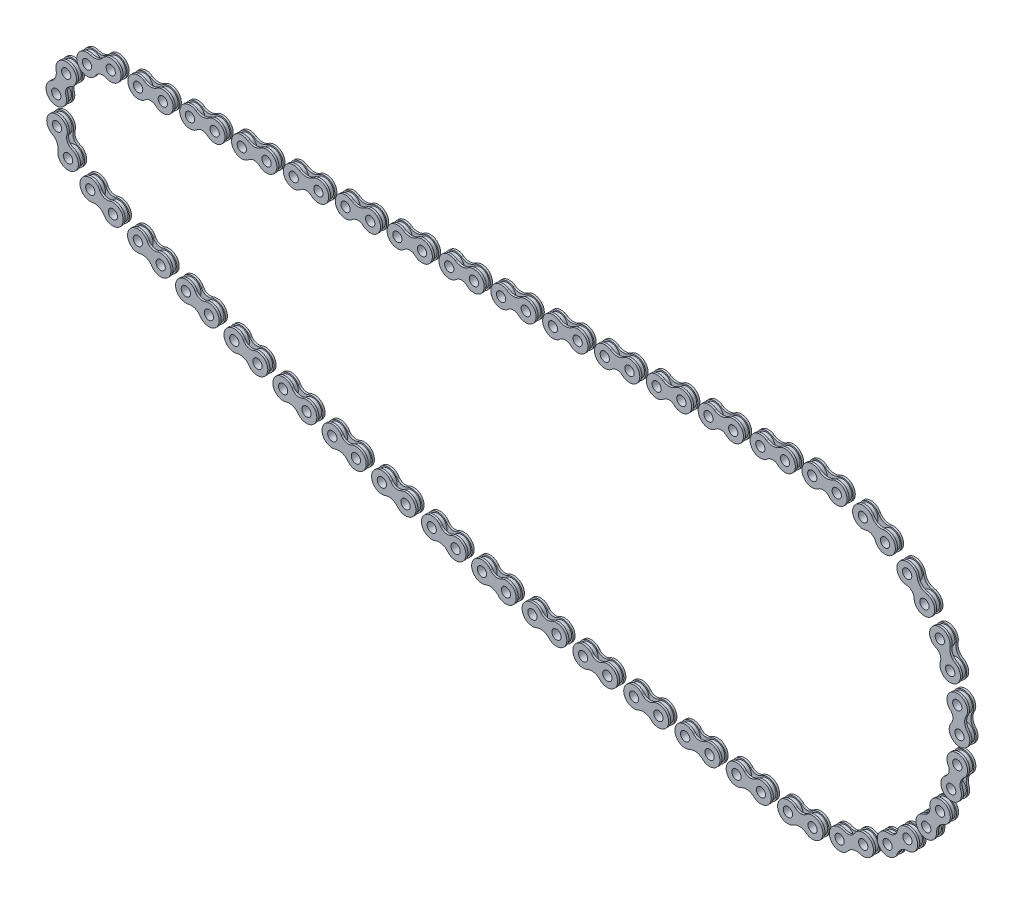
from build123d import *

# Parameters (mm, degrees)
SKETCH1_R             = 4.445
SKETCH1_R_2           = 2.286
BOSS_EXTRUDE1_DEPTH   = 1.016
BOSS_EXTRUDE1_2_DEPTH = 1.016
SKETCH2_R             = 2.286
BOSS_EXTRUDE2_DEPTH   = 1.016
CRVPATTERN1_5_ANGLE   = 6.5404685
CRVPATTERN1_6_ANGLE   = 26.1055224
CRVPATTERN1_7_ANGLE   = 45.6705764
CRVPATTERN1_8_ANGLE   = 65.2356303
CRVPATTERN1_9_ANGLE   = 84.8006843
CRVPATTERN1_10_ANGLE  = 104.3657382
CRVPATTERN1_11_ANGLE  = 123.9307922
CRVPATTERN1_12_ANGLE  = 143.4958461
CRVPATTERN1_13_ANGLE  = 163.0609
CRVPATTERN1_14_ANGLE  = 177.374046
CRVPATTERN1_15_ANGLE  = 172.7025231
CRVPATTERN1_16_ANGLE  = 171.4340196
CRVPATTERN1_17_ANGLE  = 170.1655161
CRVPATTERN1_18_ANGLE  = 168.8970126
CRVPATTERN1_19_ANGLE  = 167.6285091
CRVPATTERN1_20_ANGLE  = 166.3600056
CRVPATTERN1_21_ANGLE  = 165.0915021
CRVPATTERN1_22_ANGLE  = 163.8229986
CRVPATTERN1_23_ANGLE  = 162.5544951
CRVPATTERN1_24_ANGLE  = 161.2859916
CRVPATTERN1_25_ANGLE  = 160.0174881
CRVPATTERN1_26_ANGLE  = 158.7489846
CRVPATTERN1_27_ANGLE  = 157.4804811
CRVPATTERN1_28_ANGLE  = 156.2119776
CRVPATTERN1_29_ANGLE  = 116.6268588
CRVPATTERN1_30_ANGLE  = 66.4382422
CRVPATTERN1_31_ANGLE  = 16.2496255


with BuildPart() as part:
    # Sketch1 → Boss-Extrude1 (new, symmetric)
    with BuildSketch(Plane.XY):
        with Locations((-6.096, 0)):
            Circle(SKETCH1_R)
        with Locations((-6.096, 0)):
            Circle(SKETCH1_R_2, mode=Mode.SUBTRACT)
    extrude(amount=BOSS_EXTRUDE1_DEPTH, both=True)



with BuildPart() as body_2:
    # Sketch1 → Boss-Extrude1 2 (new, symmetric)
    with BuildSketch(Plane.XY):
        with Locations(Location((6.096, 0, 0), (0, 0, 180))):
            Circle(SKETCH1_R)
        with Locations((6.096, 0)):
            Circle(SKETCH1_R_2, mode=Mode.SUBTRACT)
    extrude(amount=BOSS_EXTRUDE1_2_DEPTH, both=True)


with BuildPart() as part_1:
    add(part.part)

    add(body_2.part)  # Boss-Extrude2 merges body 2
    # Sketch2 → Boss-Extrude2 (add)
    with BuildSketch(Plane.XY.offset(1.016)):
        with BuildLine():
            ThreePointArc((-3.149213448, 4.13797644), (-11.165699297, -0.323340436), (-2.647396243, -3.730084734))
            ThreePointArc((-2.647396243, -3.730084734), (0, -2.6937927), (2.647396243, -3.730084734))
            ThreePointArc((2.647396243, -3.730084734), (11.165699297, -0.323340436), (3.149213448, 4.13797644))
            ThreePointArc((3.149213448, 4.13797644), (0, 3.131241405), (-3.149213448, 4.13797644))
        make_face()
        with Locations((6.096, 0)):
            Circle(SKETCH2_R, mode=Mode.SUBTRACT)
        with Locations((-6.096, 0)):
            Circle(SKETCH2_R, mode=Mode.SUBTRACT)
    extrude(amount=BOSS_EXTRUDE2_DEPTH)

    # Mirror1: part across plane


with BuildPart() as part_2:
    add(part_1.part)
    add(part_1.part.mirror(Plane.XY))


with BuildPart() as body_2_2:
    # CrvPattern1: read off the stored shape, not the designer's step
    # CrvPattern1: copy of part
    add(part_2.part.moved(Location((25.5866925, 0, 0))))


with BuildPart() as body_3:
    # CrvPattern1 2: copy of part
    add(part_2.part.moved(Location((51.173385, 0, 0))))


with BuildPart() as body_4:
    # CrvPattern1 3: copy of part
    add(part_2.part.moved(Location((76.7600775, 0, 0))))


with BuildPart() as body_5:
    # CrvPattern1 4: copy of part
    add(part_2.part.moved(Location((102.34677, 0, 0))))


with BuildPart() as body_6:
    # CrvPattern1 5: copy of part
    add(part_2.part.moved(Location((127.134345, 14.085439, 0))).rotate(Axis((0, 0, 0), (0, 0, -1)), CRVPATTERN1_5_ANGLE))


with BuildPart() as body_7:
    # CrvPattern1 6: copy of part
    add(part_2.part.moved(Location((140.1587419, 60.1710301, 0))).rotate(Axis((0, 0, 0), (0, 0, -1)), CRVPATTERN1_6_ANGLE))


with BuildPart() as body_8:
    # CrvPattern1 7: copy of part
    add(part_2.part.moved(Location((136.9981336, 107.9572957, 0))).rotate(Axis((0, 0, 0), (0, 0, -1)), CRVPATTERN1_7_ANGLE))


with BuildPart() as body_9:
    # CrvPattern1 8: copy of part
    add(part_2.part.moved(Location((118.0174951, 151.9260573, 0))).rotate(Axis((0, 0, 0), (0, 0, -1)), CRVPATTERN1_8_ANGLE))


with BuildPart() as body_10:
    # CrvPattern1 9: copy of part
    add(part_2.part.moved(Location((85.4086395, 186.9999673, 0))).rotate(Axis((0, 0, 0), (0, 0, -1)), CRVPATTERN1_9_ANGLE))


with BuildPart() as body_11:
    # CrvPattern1 10: copy of part
    add(part_2.part.moved(Location((42.9371149, 209.1288223, 0))).rotate(Axis((0, 0, 0), (0, 0, -1)), CRVPATTERN1_10_ANGLE))


with BuildPart() as body_12:
    # CrvPattern1 11: copy of part
    add(part_2.part.moved(Location((-4.4926265, 215.7572653, 0))).rotate(Axis((0, 0, 0), (0, 0, -1)), CRVPATTERN1_11_ANGLE))


with BuildPart() as body_13:
    # CrvPattern1 12: copy of part
    add(part_2.part.moved(Location((-51.4035763, 206.1198684, 0))).rotate(Axis((0, 0, 0), (0, 0, -1)), CRVPATTERN1_12_ANGLE))


with BuildPart() as body_14:
    # CrvPattern1 13: copy of part
    add(part_2.part.moved(Location((-92.3786341, 181.3295222, 0))).rotate(Axis((0, 0, 0), (0, 0, -1)), CRVPATTERN1_13_ANGLE))


with BuildPart() as body_15:
    # CrvPattern1 14: copy of part
    add(part_2.part.moved(Location((-122.6861541, 144.2489227, 0))).rotate(Axis((0, 0, 0), (0, 0, 1)), CRVPATTERN1_14_ANGLE))


with BuildPart() as body_16:
    # CrvPattern1 15: copy of part
    add(part_2.part.moved(Location((-108.4503689, 134.2020966, 0))).rotate(Axis((0, 0, 0), (0, 0, 1)), CRVPATTERN1_15_ANGLE))


with BuildPart() as body_17:
    # CrvPattern1 16: copy of part
    add(part_2.part.moved(Location((-85.8108187, 132.0515799, 0))).rotate(Axis((0, 0, 0), (0, 0, 1)), CRVPATTERN1_16_ANGLE))


with BuildPart() as body_18:
    # CrvPattern1 17: copy of part
    add(part_2.part.moved(Location((-63.1292092, 130.402779, 0))).rotate(Axis((0, 0, 0), (0, 0, 1)), CRVPATTERN1_17_ANGLE))


with BuildPart() as body_19:
    # CrvPattern1 18: copy of part
    add(part_2.part.moved(Location((-40.4166575, 129.2565021, 0))).rotate(Axis((0, 0, 0), (0, 0, 1)), CRVPATTERN1_18_ANGLE))


with BuildPart() as body_20:
    # CrvPattern1 19: copy of part
    add(part_2.part.moved(Location((-17.684296, 128.613311, 0))).rotate(Axis((0, 0, 0), (0, 0, 1)), CRVPATTERN1_19_ANGLE))


with BuildPart() as body_21:
    # CrvPattern1 20: copy of part
    add(part_2.part.moved(Location((5.0567333, 128.4735209, 0))).rotate(Axis((0, 0, 0), (0, 0, 1)), CRVPATTERN1_20_ANGLE))


with BuildPart() as body_22:
    # CrvPattern1 21: copy of part
    add(part_2.part.moved(Location((27.7952841, 128.8372004, 0))).rotate(Axis((0, 0, 0), (0, 0, 1)), CRVPATTERN1_21_ANGLE))


with BuildPart() as body_23:
    # CrvPattern1 22: copy of part
    add(part_2.part.moved(Location((50.5202113, 129.7041713, 0))).rotate(Axis((0, 0, 0), (0, 0, 1)), CRVPATTERN1_22_ANGLE))


with BuildPart() as body_24:
    # CrvPattern1 23: copy of part
    add(part_2.part.moved(Location((73.2203765, 131.0740085, 0))).rotate(Axis((0, 0, 0), (0, 0, 1)), CRVPATTERN1_23_ANGLE))


with BuildPart() as body_25:
    # CrvPattern1 24: copy of part
    add(part_2.part.moved(Location((95.8846535, 132.9460406, 0))).rotate(Axis((0, 0, 0), (0, 0, 1)), CRVPATTERN1_24_ANGLE))


with BuildPart() as body_26:
    # CrvPattern1 25: copy of part
    add(part_2.part.moved(Location((118.5019335, 135.3193502, 0))).rotate(Axis((0, 0, 0), (0, 0, 1)), CRVPATTERN1_25_ANGLE))


with BuildPart() as body_27:
    # CrvPattern1 26: copy of part
    add(part_2.part.moved(Location((141.061131, 138.1927739, 0))).rotate(Axis((0, 0, 0), (0, 0, 1)), CRVPATTERN1_26_ANGLE))


with BuildPart() as body_28:
    # CrvPattern1 27: copy of part
    add(part_2.part.moved(Location((163.5511888, 141.5649034, 0))).rotate(Axis((0, 0, 0), (0, 0, 1)), CRVPATTERN1_27_ANGLE))


with BuildPart() as body_29:
    # CrvPattern1 28: copy of part
    add(part_2.part.moved(Location((185.9610835, 145.4340859, 0))).rotate(Axis((0, 0, 0), (0, 0, 1)), CRVPATTERN1_28_ANGLE))


with BuildPart() as body_30:
    # CrvPattern1 29: copy of part
    add(part_2.part.moved(Location((73.4098027, 240.7077324, 0))).rotate(Axis((0, 0, 0), (0, 0, 1)), CRVPATTERN1_29_ANGLE))


with BuildPart() as body_31:
    # CrvPattern1 30: copy of part
    add(part_2.part.moved(Location((-115.4859782, 221.0029082, 0))).rotate(Axis((0, 0, 0), (0, 0, 1)), CRVPATTERN1_30_ANGLE))


with BuildPart() as body_32:
    # CrvPattern1 31: copy of part
    add(part_2.part.moved(Location((-221.292445, 63.2851613, 0))).rotate(Axis((0, 0, 0), (0, 0, 1)), CRVPATTERN1_31_ANGLE))


with BuildPart() as body_33:
    # CrvPattern1 32: copy of part
    add(part_2.part.moved(Location((-204.69354, 0, 0))))


with BuildPart() as body_34:
    # CrvPattern1 33: copy of part
    add(part_2.part.moved(Location((-179.1068475, 0, 0))))


with BuildPart() as body_35:
    # CrvPattern1 34: copy of part
    add(part_2.part.moved(Location((-153.520155, 0, 0))))


with BuildPart() as body_36:
    # CrvPattern1 35: copy of part
    add(part_2.part.moved(Location((-127.9334625, 0, 0))))


with BuildPart() as body_37:
    # CrvPattern1 36: copy of part
    add(part_2.part.moved(Location((-102.34677, 0, 0))))


with BuildPart() as body_38:
    # CrvPattern1 37: copy of part
    add(part_2.part.moved(Location((-76.7600775, 0, 0))))


with BuildPart() as body_39:
    # CrvPattern1 38: copy of part
    add(part_2.part.moved(Location((-51.173385, 0, 0))))


with BuildPart() as body_40:
    # CrvPattern1 39: copy of part
    add(part_2.part.moved(Location((-25.5866925, 0, 0))))


solid = Compound([part_2.part, body_2_2.part, body_3.part, body_4.part, body_5.part, body_6.part, body_7.part, body_8.part, body_9.part, body_10.part, body_11.part, body_12.part, body_13.part, body_14.part, body_15.part, body_16.part, body_17.part, body_18.part, body_19.part, body_20.part, body_21.part, body_22.part, body_23.part, body_24.part, body_25.part, body_26.part, body_27.part, body_28.part, body_29.part, body_30.part, body_31.part, body_32.part, body_33.part, body_34.part, body_35.part, body_36.part, body_37.part, body_38.part, body_39.part, body_40.part])
